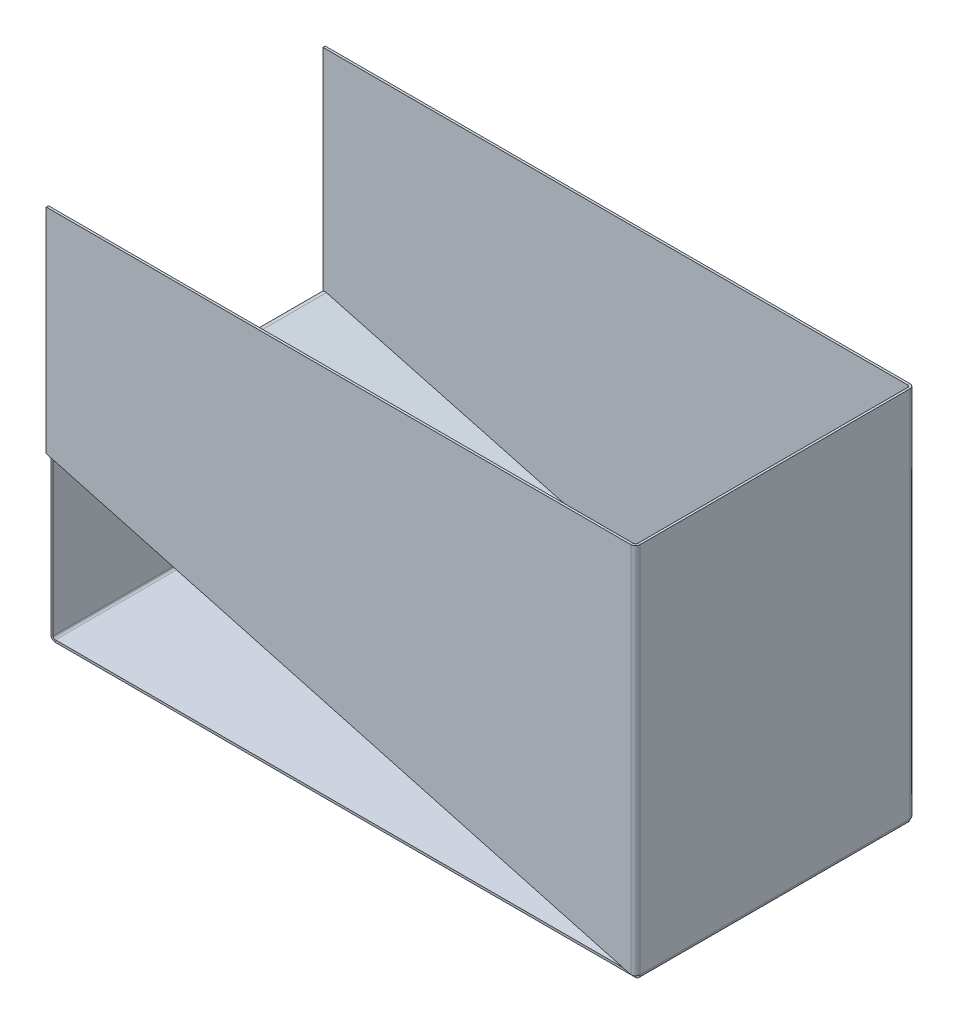
from build123d import *

# Parameters (mm, degrees)
SKETCH3_W                    = 195
SKETCH3_H                    = 90
BASE_FLANGE1_DEPTH           = 0.76
EDGE_FLANGE1_STRIP_W         = 4.564
EDGE_FLANGE1_STRIP_H         = 0.76
EDGE_FLANGE1_STRIP_CUT_DEPTH = 90
EDGE_FLANGE1_DEPTH           = 90
EDGE_FLANGE2_STRIP_CUT_DEPTH = 90
EDGE_FLANGE2_DEPTH           = 90
EDGE_FLANGE3_STRIP_W         = 4.564
EDGE_FLANGE3_STRIP_H         = 0.76
EDGE_FLANGE3_STRIP_CUT_DEPTH = 90
EDGE_FLANGE3_DEPTH           = 90
EDGE_FLANGE6_DEPTH           = 124.238
EDGE_FLANGE7_DEPTH           = 124.238
CUT_EXTRUDE1_REACH           = 252.208


# Sheet-metal steps are written as plain solids
with BuildPart() as part:
    # Sketch3 → Base-Flange1 (new body)
    with BuildSketch(Plane(origin=(0, 0, 0), x_dir=(1, 0, 0), z_dir=(0, 1, 0))):
        with Locations((-97.5, 45)):
            Rectangle(SKETCH3_W, SKETCH3_H)
    extrude(amount=-BASE_FLANGE1_DEPTH)

    # Edge-Flange1 strip (across the edge) → Edge-Flange1 strip cut (cut)
    with BuildSketch(Plane(origin=(-195, 0, -90), x_dir=(1, 0, 0), z_dir=(0, 0, 1))):
        with Locations((-1.52, -0.38)):
            Rectangle(EDGE_FLANGE1_STRIP_W, EDGE_FLANGE1_STRIP_H)
    extrude(amount=EDGE_FLANGE1_STRIP_CUT_DEPTH, mode=Mode.SUBTRACT)

    # Edge-Flange1 section (across the edge) → Edge-Flange1 (add)
    with BuildSketch(Plane(origin=(-195, 0, -90), x_dir=(1, 0, 0), z_dir=(0, 0, 1))):
        with BuildLine():
            Line((-0.76, 0.762), (-0.76, 55))
            Line((-0.76, 55), (0, 55))
            Line((0, 55), (0, 0.762))
            ThreePointArc((0, 0.762), (0.223184633, 0.223184633), (0.762, 0))
            Line((0.762, 0), (0.762, -0.76))
            ThreePointArc((0.762, -0.76), (-0.314216521, -0.314216521), (-0.76, 0.762))
        make_face()
    extrude(amount=EDGE_FLANGE1_DEPTH)

    # Edge-Flange2 strip (across the edge) → Edge-Flange2 strip cut (cut)
    with BuildSketch(Plane(origin=(-195, 55, -90), x_dir=(-0.2588190451025146, -0.96592582628907, 0), z_dir=(0, 0, 1))):
        Polygon((-4.589327535, -2.016516504), (1.155922587, -0.477081374), (0.959220112, 0.257022254), (-4.786030009, -1.282412876), align=None)
    extrude(amount=EDGE_FLANGE2_STRIP_CUT_DEPTH, mode=Mode.SUBTRACT)

    # Edge-Flange2 section (across the edge) → Edge-Flange2 (add)
    with BuildSketch(Plane(origin=(-195, 55, -90), x_dir=(-0.2588190451025146, -0.96592582628907, 0), z_dir=(0, 0, 1))):
        with BuildLine():
            Line((-0.76, 0.993057734), (-0.76, 200))
            Line((-0.76, 200), (0, 200))
            Line((0, 200), (0, 0.993057734))
            ThreePointArc((0, 0.993057734), (0.298123791, 0.388522489), (0.959220112, 0.257022254))
            Line((0.959220112, 0.257022254), (1.155922587, -0.477081374))
            ThreePointArc((1.155922587, -0.477081374), (-0.164534895, -0.21442605), (-0.76, 0.993057734))
        make_face()
    extrude(amount=EDGE_FLANGE2_DEPTH)

    # Edge-Flange3 strip (across the edge) → Edge-Flange3 strip cut (cut)
    with BuildSketch(Plane(origin=(0, 0, 0), x_dir=(-1, 0, 0), z_dir=(0, 0, -1))):
        with Locations((-1.52, -0.38)):
            Rectangle(EDGE_FLANGE3_STRIP_W, EDGE_FLANGE3_STRIP_H)
    extrude(amount=EDGE_FLANGE3_STRIP_CUT_DEPTH, mode=Mode.SUBTRACT)

    # Edge-Flange3 section (across the edge) → Edge-Flange3 (add)
    with BuildSketch(Plane(origin=(0, 0, 0), x_dir=(-1, 0, 0), z_dir=(0, 0, -1))):
        with BuildLine():
            Line((-0.76, 0.762), (-0.76, 125))
            Line((-0.76, 125), (0, 125))
            Line((0, 125), (0, 0.762))
            ThreePointArc((0, 0.762), (0.223184633, 0.223184633), (0.762, 0))
            Line((0.762, 0), (0.762, -0.76))
            ThreePointArc((0.762, -0.76), (-0.314216521, -0.314216521), (-0.76, 0.762))
        make_face()
    extrude(amount=EDGE_FLANGE3_DEPTH)

    # Edge-Flange6 section (across the edge) → Edge-Flange6 (add)
    with BuildSketch(Plane(origin=(0, 0.762, 0.762), x_dir=(0, 0, -1), z_dir=(0, 1, 0))):
        with BuildLine():
            Line((-0.76, 0.762), (-0.76, 195.76))
            Line((-0.76, 195.76), (0, 195.76))
            Line((0, 195.76), (0, 0.762))
            ThreePointArc((0, 0.762), (0.223184633, 0.223184633), (0.762, 0))
            Line((0.762, 0), (0.762, -0.76))
            ThreePointArc((0.762, -0.76), (-0.314216521, -0.314216521), (-0.76, 0.762))
        make_face()
    extrude(amount=EDGE_FLANGE6_DEPTH)

    # Edge-Flange7 section (across the edge) → Edge-Flange7 (add)
    with BuildSketch(Plane(origin=(0, 125, -90.762), x_dir=(0, 0, 1), z_dir=(0, -1, 0))):
        with BuildLine():
            Line((-0.76, 0.762), (-0.76, 195.76))
            Line((-0.76, 195.76), (0, 195.76))
            Line((0, 195.76), (0, 0.762))
            ThreePointArc((0, 0.762), (0.223184633, 0.223184633), (0.762, 0))
            Line((0.762, 0), (0.762, -0.76))
            ThreePointArc((0.762, -0.76), (-0.314216521, -0.314216521), (-0.76, 0.762))
        make_face()
    extrude(amount=EDGE_FLANGE7_DEPTH)

    # Sketch29 → Cut-Extrude1 (cut, up to next)
    with BuildSketch(Plane.XY.offset(1.522), mode=Mode.PRIVATE) as cut_extrude1_sk1:
        Polygon((-195.76, 53.762), (-0.762, 0.762), (-195.76, 0.762), align=None)
    cut_extrude1_tool1 = extrude(cut_extrude1_sk1.sketch, amount=-CUT_EXTRUDE1_REACH, mode=Mode.PRIVATE) & part.part
    add(cut_extrude1_tool1.solids().sort_by_distance((-130.760667, 18.428667, 1.522))[0], mode=Mode.SUBTRACT)


solid = part.part
